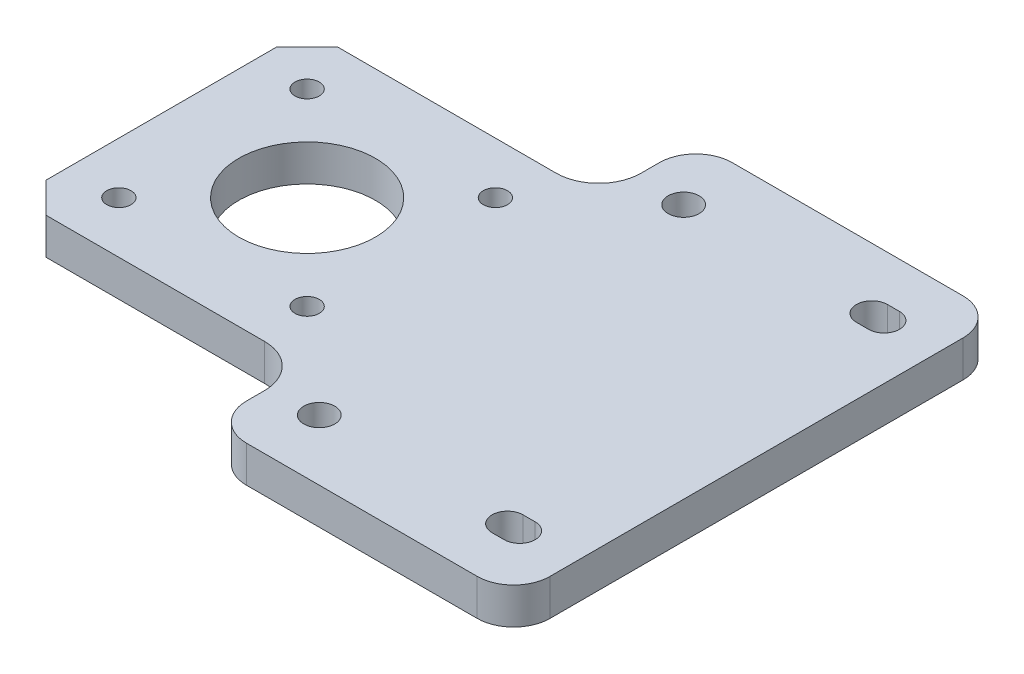
from build123d import *

# Parameters (mm, degrees)
SKETCH_1_R          = 11.25
SKETCH_1_R_2        = 2
EXTRUDE_1_DEPTH     = 6
SKETCH_2_R          = 2.55
CUT_EXTRUDE_1_DEPTH = 84.456575535


with BuildPart() as part:
    # Эскиз1 → Бобышка-Вытянуть1 (new body)
    with BuildSketch(Plane(origin=(0, 0, 0), x_dir=(1, 0, 0), z_dir=(0, 1, 0))):
        with BuildLine():
            Line((-32, -24), (-68, -24))
            Line((-68, -24), (-73, -19))
            Line((-73, -19), (-73, 19))
            Line((-73, 19), (-68, 24))
            Line((-68, 24), (-32, 24))
            ThreePointArc((-32, 24), (-27.050252532, 26.050252532), (-25, 31))
            Line((-25, 31), (-25, 34))
            ThreePointArc((-25, 34), (-23.242640687, 38.242640687), (-19, 40))
            Line((-19, 40), (19, 40))
            ThreePointArc((19, 40), (23.242640687, 38.242640687), (25, 34))
            Line((25, 34), (25, -34))
            ThreePointArc((25, -34), (23.242640687, -38.242640687), (19, -40))
            Line((19, -40), (-19, -40))
            ThreePointArc((-19, -40), (-23.242640687, -38.242640687), (-25, -34))
            Line((-25, -34), (-25, -31))
            ThreePointArc((-25, -31), (-27.050252532, -26.050252532), (-32, -24))
        make_face()
        with Locations((-49, 0)):
            Circle(SKETCH_1_R, mode=Mode.SUBTRACT)
        with Locations((-64.5, 15.5)):
            Circle(SKETCH_1_R_2, mode=Mode.SUBTRACT)
        with Locations((-64.5, -15.5)):
            Circle(SKETCH_1_R_2, mode=Mode.SUBTRACT)
        with Locations((-33.5, 15.5)):
            Circle(SKETCH_1_R_2, mode=Mode.SUBTRACT)
        with Locations((-33.5, -15.5)):
            Circle(SKETCH_1_R_2, mode=Mode.SUBTRACT)
    extrude(amount=EXTRUDE_1_DEPTH)

    # Эскиз2 → Вырез-Вытянуть1 (cut, through all)
    with BuildSketch(Plane.XZ):
        with Locations((-17, -30)):
            Circle(SKETCH_2_R)
        with Locations((-17, 30)):
            Circle(SKETCH_2_R)
        with BuildLine():
            Line((16, -32.55), (14, -32.55))
            ThreePointArc((14, -32.55), (11.45, -30), (14, -27.45))
            Line((14, -27.45), (16, -27.45))
            ThreePointArc((16, -27.45), (18.55, -30), (16, -32.55))
        make_face()
        with BuildLine():
            Line((16, 32.55), (14, 32.55))
            ThreePointArc((14, 32.55), (11.45, 30), (14, 27.45))
            Line((14, 27.45), (16, 27.45))
            ThreePointArc((16, 27.45), (18.55, 30), (16, 32.55))
        make_face()
    extrude(amount=-CUT_EXTRUDE_1_DEPTH, mode=Mode.SUBTRACT)


solid = part.part
